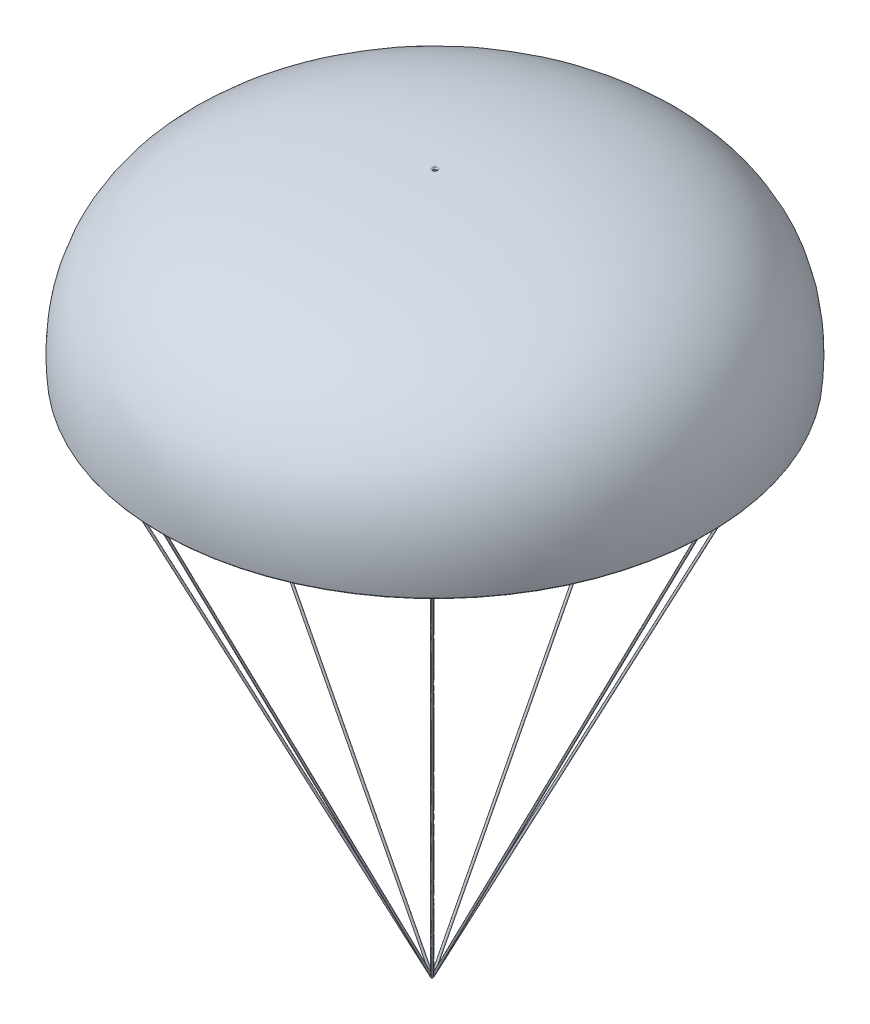
from build123d import *

# Parameters (mm, degrees)
SKETCH3_R         = 2
CIRPATTERN1_COUNT = 8


with BuildPart() as part:
    # Sketch1 → Revolve2 (revolve)
    with BuildSketch(Plane.XY):
        with BuildLine():
            ThreePointArc((-0.008000206, 1.999983999), (1.999983999, 0.008000206), (0.008000206, -1.999983999))
            add(Edge.make_bspline(
                [(0.008000206, -1.999983999), (-2.582909479, -2.010347988), (-7.780261021, -2.043581936), (-18.049930135, -2.159321947), (-30.738750505, -2.396720888), (-45.701047393, -2.82982904), (-65.30795641, -3.60495365), (-89.169311068, -4.944369116), (-116.768428773, -7.144261749), (-143.332408516, -9.93647616), (-177.37064053, -14.448754328), (-217.329422924, -21.568166123), (-261.13549619, -32.474053985), (-300.795613707, -45.737194488), (-336.309785174, -61.350743491), (-367.680891798, -79.306758338), (-394.916311721, -99.597696088), (-418.028835567, -122.219398571), (-437.035225962, -147.174904624), (-451.951464502, -174.476485625), (-460.980979288, -199.19875502), (-466.164027699, -220.168740363), (-469.030175063, -236.494196922), (-470.874142465, -253.419234129), (-471.557937624, -268.023778638), (-471.59257566, -280.008413179), (-471.36230335, -289.146253996), (-470.956371751, -296.889614519), (-470.503954587, -303.152398805), (-470.23377393, -306.321799102), (-470.089115832, -307.900416094)],
                knots=[0, 0, 0, 0, 0.0078125, 0.015625, 0.03125, 0.046875, 0.0625, 0.09375, 0.125, 0.15625, 0.1875, 0.25, 0.3125, 0.375, 0.4375, 0.5, 0.5625, 0.625, 0.6875, 0.75, 0.8125, 0.84375, 0.875, 0.90625, 0.9375, 0.953125, 0.96875, 0.984375, 0.9921875, 1, 1, 1, 1], degree=3))
            ThreePointArc((-470.089115832, -307.900416094), (-471.898263928, -310.07457873), (-474.072426564, -308.265430634))
            add(Edge.make_bspline(
                [(-0.008000206, 1.999983999), (-2.60534002, 1.989594289), (-7.815474152, 1.956278713), (-18.111327866, 1.840244805), (-30.833632649, 1.602223185), (-45.837504294, 1.16791736), (-65.501732599, 0.390534307), (-89.438440263, -0.953066451), (-117.134390572, -3.160614988), (-143.802130663, -5.963660483), (-177.988657488, -10.495488227), (-218.152825638, -17.650757153), (-262.241534267, -28.625763639), (-302.223429691, -41.994794928), (-338.098504944, -57.764695167), (-369.863878086, -75.943407022), (-397.512171174, -96.538473395), (-421.030593519, -119.55405259), (-440.402382555, -144.987105285), (-455.611556517, -172.825361906), (-464.809246888, -198.012350644), (-470.081578295, -219.345420449), (-472.993776579, -235.935047522), (-474.864953648, -253.113016715), (-475.557815314, -267.917171572), (-475.592840789, -280.054127548), (-475.359743399, -289.302463692), (-474.949127542, -297.134648338), (-474.491696128, -303.466718189), (-474.218639252, -306.669848803), (-474.072426564, -308.265430634)],
                knots=[0, 0, 0, 0, 0.0078125, 0.015625, 0.03125, 0.046875, 0.0625, 0.09375, 0.125, 0.15625, 0.1875, 0.25, 0.3125, 0.375, 0.4375, 0.5, 0.5625, 0.625, 0.6875, 0.75, 0.8125, 0.84375, 0.875, 0.90625, 0.9375, 0.953125, 0.96875, 0.984375, 0.9921875, 1, 1, 1, 1], degree=3))
        make_face()
    revolve(axis=Axis((4.89769373, 0, 0), (0, -1, 0)))

    # Sweep1: sweep along a path in Sketch4
    with BuildLine(Plane.XY) as sweep1_path:
        Line((-472.064303065, -308.265430634), (0, -1222.665430634))
    # Sketch3 → Sweep1 (sweep)
    with BuildSketch(Plane(origin=(0, -308.265430634, 0), x_dir=(1, 0, 0), z_dir=(0, 1, 0))):
        with Locations((-472.064303065, 0)):
            Circle(SKETCH3_R)
    sweep1 = sweep(path=sweep1_path.line)

    # CirPattern1: Sweep1 ×8 about axis
    cirpattern1_axis = Axis((0, 0, 0), (0, 1, 0))
    for i in range(1, CIRPATTERN1_COUNT):
        add(sweep1.rotate(cirpattern1_axis, i * 360 / CIRPATTERN1_COUNT))


solid = part.part
